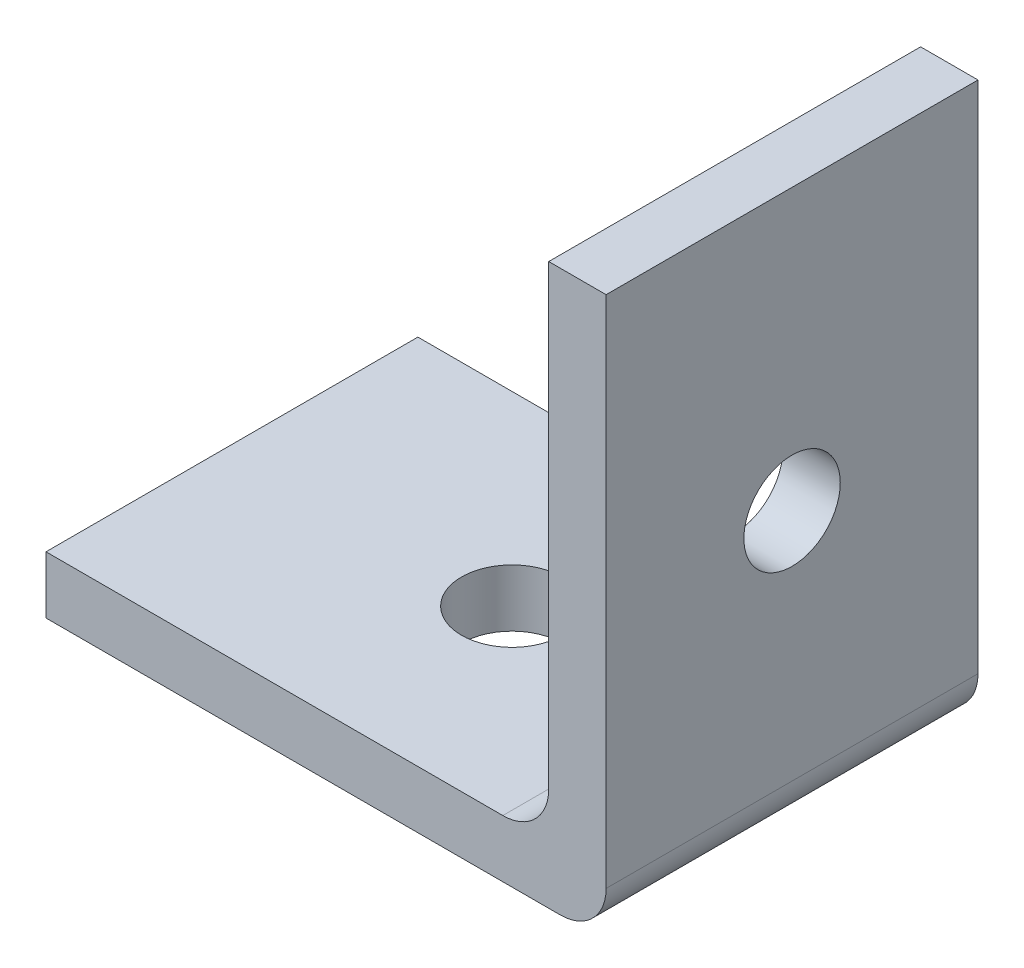
from build123d import *

# Parameters (mm, degrees)
BOSS_EXTRUDE1_DEPTH = 20.574
FILLET1_R           = 2.54
FILLET2_R           = 2.54
SKETCH2_R           = 2.667
CUT_EXTRUDE1_DEPTH  = 48.412393108
SKETCH3_R           = 2.794
CUT_EXTRUDE2_DEPTH  = 41.294039956


with BuildPart() as part:
    # Sketch1 → Boss-Extrude1 (new body)
    with BuildSketch(Plane.XY):
        Polygon((12.319, 1.5875), (12.319, 29.4005), (15.494, 29.4005), (15.494, -1.5875), (-15.494, -1.5875), (-15.494, 1.5875), align=None)
    extrude(amount=BOSS_EXTRUDE1_DEPTH)

    # Fillet1
    fillet1_edges = [part.edges().sort_by_distance(p)[0] for p in [
        (12.319, 1.5875, 10.287),
    ]]
    fillet(fillet1_edges, radius=FILLET1_R)

    # Fillet2
    fillet2_edges = [part.edges().sort_by_distance(p)[0] for p in [
        (15.494, -1.5875, 10.287),
    ]]
    fillet(fillet2_edges, radius=FILLET2_R)

    # Sketch2 → Cut-Extrude1 (cut, through all)
    with BuildSketch(Plane(origin=(15.494, 0, 0), x_dir=(0, 0, -1), z_dir=(1, 0, 0))):
        with Locations((-10.287, 13.9065)):
            Circle(SKETCH2_R)
    extrude(amount=-CUT_EXTRUDE1_DEPTH, mode=Mode.SUBTRACT)

    # Sketch3 → Cut-Extrude2 (cut, through all)
    with BuildSketch(Plane.XZ.offset(1.5875)):
        with Locations((0, 10.287)):
            Circle(SKETCH3_R)
    extrude(amount=-CUT_EXTRUDE2_DEPTH, mode=Mode.SUBTRACT)


solid = part.part
